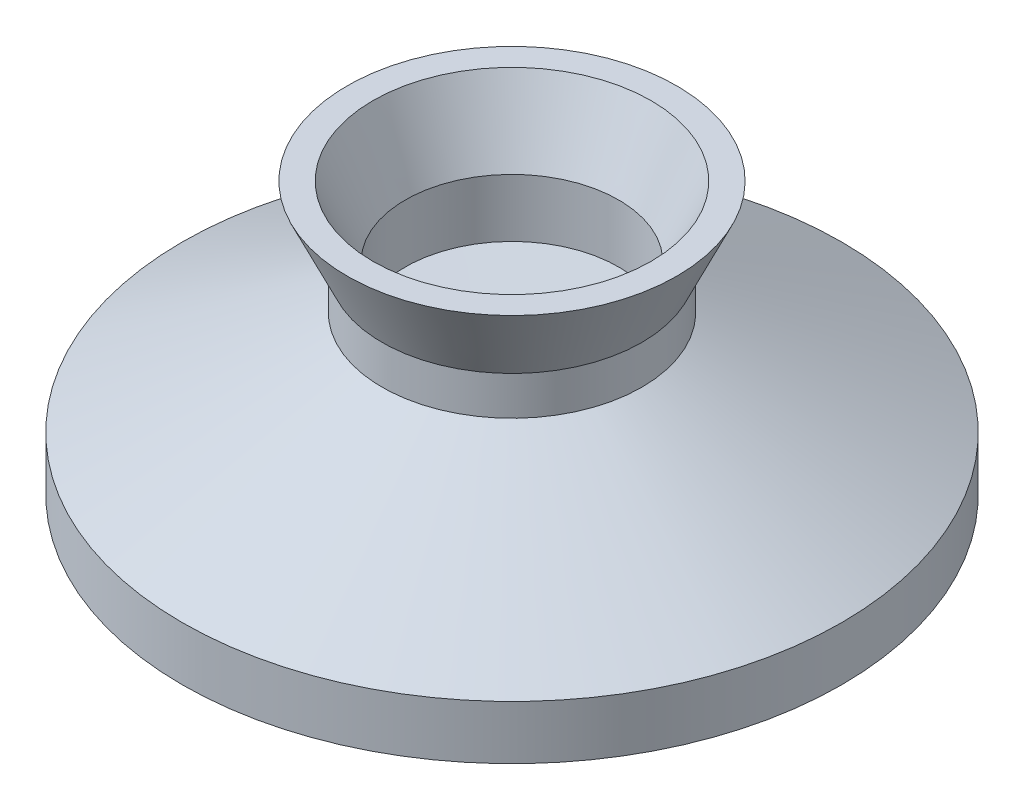
from build123d import *


with BuildPart() as part:
    # Sketch1 → Revolve2 (revolve)
    with BuildSketch(Plane.XY):
        Polygon((78.47179939, -20.475690932), (4.5, -25), (4.5, -31), (85, -31), (85, -17.109765388), (33.5, 9.699437715), (33.5, 19.699437715), (42.5, 39), (35.879732486, 39), (27.5, 21.029605691), (27.5, 6.058548338), align=None)
    revolve(axis=Axis((1e-09, -1021.213113582, 0), (0, 1, 0)))


solid = part.part
